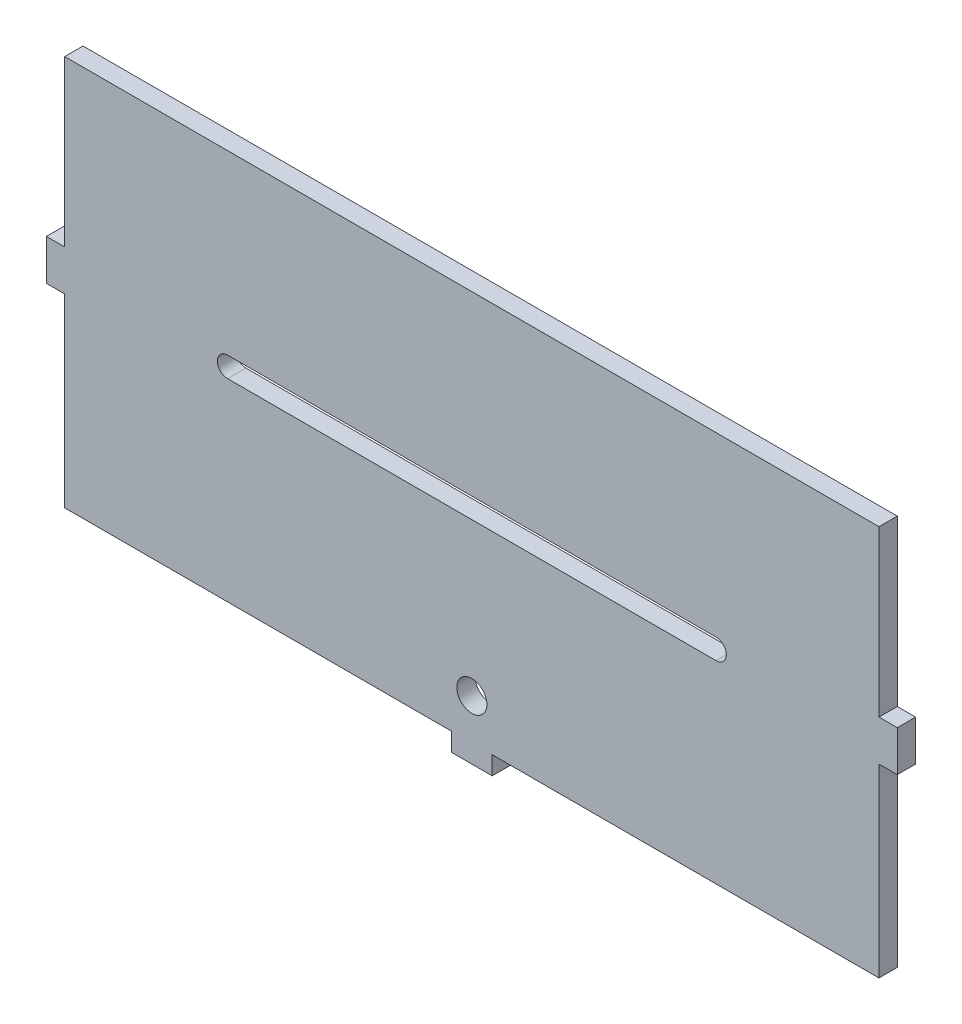
from build123d import *

# Parameters (mm, degrees)
BOSS_EXTRUDE1_DEPTH     = 5.715
CUT_EXTRUDE1_DEPTH      = 150.788680063
CUT_EXTRUDE2_DEPTH      = 150.788680063
CUT_EXTRUDE2_DEPTH_BACK = 150.788680063
SKETCH4_R               = 4.699
SKETCH5_W               = 254
SKETCH5_H               = 5.08
CUT_EXTRUDE3_DEPTH      = 150.788680063


with BuildPart() as part:
    # Sketch1 → Boss-Extrude1 (new body)
    with BuildSketch(Plane.XY):
        Polygon((6.35, -63.5), (127, -63.5), (127, -5.715), (132.715, -5.715), (132.715, 6.985), (127, 6.985), (127, 63.5), (-127, 63.5), (-127, 6.985), (-132.715, 6.985), (-132.715, -5.715), (-127, -5.715), (-127, -63.5), (-6.35, -63.5), (-6.35, -69.215), (6.35, -69.215), align=None)
    extrude(amount=BOSS_EXTRUDE1_DEPTH)

    # Sketch2 → Cut-Extrude1 (cut, through all)
    with BuildSketch(Plane.XY.offset(5.715)):
        with BuildLine():
            Line((76.2, -3.175), (-76.2, -3.175))
            ThreePointArc((-76.2, -3.175), (-79.375, 0), (-76.2, 3.175))
            Line((-76.2, 3.175), (76.2, 3.175))
            ThreePointArc((76.2, 3.175), (79.375, 0), (76.2, -3.175))
        make_face()
    extrude(amount=-CUT_EXTRUDE1_DEPTH, mode=Mode.SUBTRACT)

    # Sketch4 → Cut-Extrude2 (cut, two sides: drawn at the far end of the back side and taken through both)
    with BuildSketch(Plane.XY.offset(5.715).offset(-CUT_EXTRUDE2_DEPTH_BACK)):
        with Locations((0, -50.8)):
            Circle(SKETCH4_R)
    extrude(amount=CUT_EXTRUDE2_DEPTH + CUT_EXTRUDE2_DEPTH_BACK, mode=Mode.SUBTRACT)

    # Sketch5 → Cut-Extrude3 (cut, through all)
    with BuildSketch(Plane.XY.offset(5.715)):
        with Locations((0, 60.96)):
            Rectangle(SKETCH5_W, SKETCH5_H)
    extrude(amount=-CUT_EXTRUDE3_DEPTH, mode=Mode.SUBTRACT)


solid = part.part
